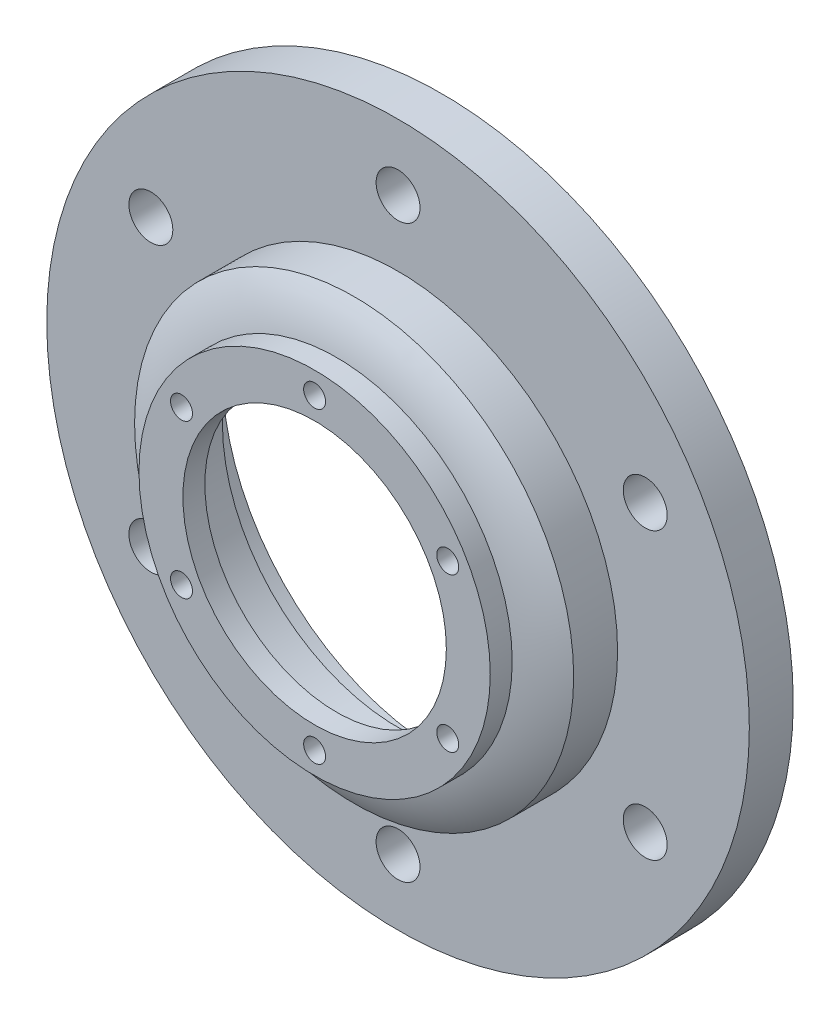
from build123d import *

# Parameters (mm, degrees)
SKETCH1_R           = 80
SKETCH1_R_2         = 50
EXTRUDE_THIN1_DEPTH = 10
SKETCH2_R           = 5
CUT_EXTRUDE1_DEPTH  = 114.578166916
SKETCH3_R           = 50
SKETCH3_R_2         = 40
EXTRUDE_THIN2_DEPTH = 10
SKETCH7_R           = 40
SKETCH7_R_2         = 30
EXTRUDE_THIN3_DEPTH = 5
SKETCH8_R           = 2.5
CUT_EXTRUDE2_DEPTH  = 117.79469166


with BuildPart() as part:
    # Sketch1 → Extrude-Thin1 (new body)
    with BuildSketch(Plane.XY):
        Circle(SKETCH1_R)
        Circle(SKETCH1_R_2, mode=Mode.SUBTRACT)
    extrude(amount=EXTRUDE_THIN1_DEPTH)

    # Sketch2 → Cut-Extrude1 (cut, through all)
    with BuildSketch(Plane.XY.offset(10)):
        with Locations((0, 65)):
            Circle(SKETCH2_R)
        with Locations((56.291651246, 32.5)):
            Circle(SKETCH2_R)
        with Locations((56.291651246, -32.5)):
            Circle(SKETCH2_R)
        with Locations((0, -65)):
            Circle(SKETCH2_R)
        with Locations((-56.291651246, -32.5)):
            Circle(SKETCH2_R)
        with Locations((-56.291651246, 32.5)):
            Circle(SKETCH2_R)
    extrude(amount=-CUT_EXTRUDE1_DEPTH, mode=Mode.SUBTRACT)


with BuildPart() as body_2:
    # Sketch3 → Extrude-Thin2 (new body)
    with BuildSketch(Plane.XY.offset(10)):
        Circle(SKETCH3_R)
        Circle(SKETCH3_R_2, mode=Mode.SUBTRACT)
    extrude(amount=EXTRUDE_THIN2_DEPTH)

    # Sketch4 → Revolve1 (revolve)
    with BuildSketch(Plane(origin=(0, 0, 0), x_dir=(0, 0, -1), z_dir=(1, 0, 0))):
        with BuildLine():
            Line((-24, 40), (-20, 40))
            Line((-20, 40), (-20, 50))
            add(Edge.make_bspline(
                [(-20, 50), (-22.936497208, 45.381576701), (-24, 40)],
                knots=[0, 0, 0, 1, 1, 1], degree=2))
        make_face()
    revolve(axis=Axis((0, 0, 0), (0, 0, 1)))


with BuildPart() as body_3:
    # Sketch7 → Extrude-Thin3 (new body)
    with BuildSketch(Plane.XY.offset(24)):
        Circle(SKETCH7_R)
        Circle(SKETCH7_R_2, mode=Mode.SUBTRACT)
    extrude(amount=EXTRUDE_THIN3_DEPTH)

    # Sketch8 → Cut-Extrude2 (cut, through all)
    with BuildSketch(Plane.XY.offset(29)):
        with Locations((0, 35)):
            Circle(SKETCH8_R)
        with Locations((30.310889132, 17.5)):
            Circle(SKETCH8_R)
        with Locations((30.310889132, -17.5)):
            Circle(SKETCH8_R)
        with Locations((0, -35)):
            Circle(SKETCH8_R)
        with Locations((-30.310889132, -17.5)):
            Circle(SKETCH8_R)
        with Locations((-30.310889132, 17.5)):
            Circle(SKETCH8_R)
    extrude(amount=-CUT_EXTRUDE2_DEPTH, mode=Mode.SUBTRACT)


solid = Compound([part.part, body_2.part, body_3.part])
